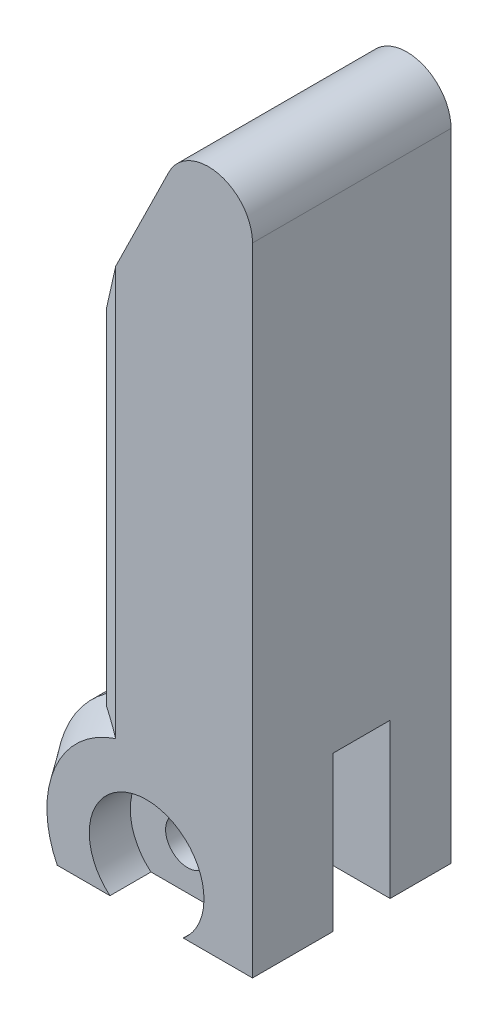
from build123d import *
from OCP.BRepFilletAPI import BRepFilletAPI_MakeChamfer

# Parameters (mm, degrees)
EXTRUDE_1_DEPTH     = 45
CHAMFER_1_SIZE      = 7
CHAMFER_1_SIZE2     = 4.901452767
CUT_EXTRUDE_START   = 13
CUT_EXTRUDE_1_DEPTH = 13
CUT_EXTRUDE_2_DEPTH = 6
CUT_EXTRUDE_3_DEPTH = 6
CHAMFER_START       = -1
CHAMFER_2_DEPTH     = 7
CHAMFER_3_SIZE      = 7
CHAMFER_3_SIZE2     = 4.901452767


with BuildPart() as part:
    # 草图1 → 凸台-拉伸1 (new body)
    with BuildSketch(Plane.XY):
        with BuildLine():
            Line((0, 0), (0, 144.272111773))
            ThreePointArc((0, 144.272111773), (-7.734402303, 154.012084416), (-18.973413415, 148.68548369))
            Line((-18.973413415, 148.68548369), (-38, 110))
            Line((-38, 110), (-38, 33.669600757))
            ThreePointArc((-38, 33.669600757), (-49.996050511, 18.969691065), (-49.617376915, 0))
            Line((-49.617376915, 0), (0, 0))
        make_face()
    extrude(amount=EXTRUDE_1_DEPTH)

    # 草图2 → 切除-旋转2 (revolve, cut)
    with BuildSketch(Plane(origin=(-24, 0, 0), x_dir=(0, 0, -1), z_dir=(1, 0, 0)), mode=Mode.PRIVATE) as cut_revolve_2_sk:
        Polygon((-45, 23), (-45, 10), (0, 10), (0, 15), (-4.3, 15), (-10.3, 15), (-10.3, 12.5), (-14.3, 12.5), (-14.3, 14), (-13.8, 14), (-13.8, 35), (-26.8, 35), (-26.8, 14), (-26.3, 14), (-26.3, 12.5), (-30.8, 12.5), (-30.8, 15), (-35.7, 15), (-35.7, 23), align=None)
    revolve(cut_revolve_2_sk.sketch.rotate(Axis((-24, 10, 45), (0, 0, -1)), 90), axis=Axis((-24, 10, 45), (0, 0, -1)), mode=Mode.SUBTRACT)

    # 倒角1
    chamfer_1_edges = [part.edges().sort_by_distance(p)[0] for p in [
        (-49.996050511, 18.969691065, 45),
        (-49.996050511, 18.969691065, 0),
    ]]
    chamfer_1_side = [part.faces().sort_by_distance(p)[0] for p in [
        (-49.996050511, 18.969691065, 22.5),
    ]]
    chamfer(chamfer_1_edges, length=CHAMFER_1_SIZE, length2=CHAMFER_1_SIZE2, reference=chamfer_1_side[0])

    # 草图4 → 切除-拉伸1 (cut)
    with BuildSketch(Plane.XY.offset(13.8).offset(CUT_EXTRUDE_START)):
        with BuildLine():
            Line((-24, 35), (0, 35))
            Line((0, 35), (0, 17))
            ThreePointArc((0, 17), (-9, 30), (-24, 35))
        make_face()
        with BuildLine():
            Line((-1.087121525, 0), (0, 0))
            Line((0, 0), (0, 3))
            ThreePointArc((0, 3), (-0.495648452, 1.482637832), (-1.087121525, 0))
        make_face()
    extrude(amount=-CUT_EXTRUDE_1_DEPTH, mode=Mode.SUBTRACT)

    # 草图7 → 切除-拉伸2 (cut)
    with BuildSketch(Plane(origin=(0, 0, 0), x_dir=(-1, 0, 0), z_dir=(0, 0, -1))):
        with BuildLine():
            Line((27.95, 1.469792729), (27.95, 4.702830945))
            ThreePointArc((27.95, 4.702830945), (28.032732694, 5.101103075), (28.267241379, 5.433474952))
            ThreePointArc((28.267241379, 5.433474952), (30.25, 10), (28.267241379, 14.566525048))
            ThreePointArc((28.267241379, 14.566525048), (28.032732694, 14.898896925), (27.95, 15.297169055))
            Line((27.95, 15.297169055), (27.95, 18.530207271))
            ThreePointArc((27.95, 18.530207271), (27.928074545, 18.997939916), (27.862490469, 19.46157046))
            Line((27.862490469, 19.46157046), (26.357995425, 27.397054331))
            ThreePointArc((26.357995425, 27.397054331), (24, 29.35), (21.642004575, 27.397054331))
            Line((21.642004575, 27.397054331), (20.137509531, 19.46157046))
            ThreePointArc((20.137509531, 19.46157046), (20.071925455, 18.997939916), (20.05, 18.530207271))
            Line((20.05, 18.530207271), (20.05, 15.297169055))
            ThreePointArc((20.05, 15.297169055), (19.967267306, 14.898896925), (19.732758621, 14.566525048))
            ThreePointArc((19.732758621, 14.566525048), (17.75, 10), (19.732758621, 5.433474952))
            ThreePointArc((19.732758621, 5.433474952), (19.967267306, 5.101103075), (20.05, 4.702830945))
            Line((20.05, 4.702830945), (20.05, 1.469792729))
            ThreePointArc((20.05, 1.469792729), (20.071925455, 1.002060084), (20.137509531, 0.53842954))
            Line((20.137509531, 0.53842954), (21.642004575, -7.397054331))
            ThreePointArc((21.642004575, -7.397054331), (24, -9.35), (26.357995425, -7.397054331))
            Line((26.357995425, -7.397054331), (27.862490469, 0.53842954))
            ThreePointArc((27.862490469, 0.53842954), (27.928074545, 1.002060084), (27.95, 1.469792729))
        make_face()
    extrude(amount=-CUT_EXTRUDE_2_DEPTH, mode=Mode.SUBTRACT)

    # 草图9 → 切除-拉伸3 (cut)
    with BuildSketch(Plane(origin=(0, 0, 0), x_dir=(-1, 0, 0), z_dir=(0, 0, -1))):
        with BuildLine():
            Line((20.137509531, 19.46157046), (19.478101846, 15.983513774))
            ThreePointArc((19.478101846, 15.983513774), (16.508016808, 9.653318796), (20.05, 3.624460807))
            Line((20.05, 3.624460807), (27.95, 3.624460807))
            ThreePointArc((27.95, 3.624460807), (31.491983192, 9.653318796), (28.521898154, 15.983513774))
            Line((28.521898154, 15.983513774), (27.862490469, 19.46157046))
            Line((27.862490469, 19.46157046), (20.137509531, 19.46157046))
        make_face()
    extrude(amount=-CUT_EXTRUDE_3_DEPTH, mode=Mode.SUBTRACT)

    # 倒角2: read off the stored shape, not the designer's step
    # 倒角2 outline → 倒角2 (cut)
    with BuildSketch(Plane.XY.offset(CHAMFER_START)):
        with BuildLine():
            Line((-20.239590839, 0), (-19.257196744, 0))
            Line((-19.257196744, 0), (-20.080386265, 0.919393486))
            ThreePointArc((-20.080386265, 0.919393486), (-20.105277636, 0.728361179), (-20.137509531, 0.53842954))
            Line((-20.137509531, 0.53842954), (-20.239590839, 0))
        make_face()
        with BuildLine():
            Line((-28.742803256, 0), (-27.760409161, 0))
            Line((-27.760409161, 0), (-27.862490469, 0.53842954))
            ThreePointArc((-27.862490469, 0.53842954), (-27.894722364, 0.728361179), (-27.919613735, 0.919393486))
            Line((-27.919613735, 0.919393486), (-28.742803256, 0))
        make_face()
    extrude(amount=CHAMFER_2_DEPTH, mode=Mode.SUBTRACT)

    # 倒角3: one chamfer whose edges measure the first distance from different faces: ONE call of the kernel's chamfer builder (chamfer() names one face for all edges)
    chamfer_3_edges_1 = [part.edges().sort_by_distance(p)[0] for p in [
        (-38, 68.86981309, 45),
    ]]
    chamfer_3_side_1 = [part.faces().sort_by_distance(p)[0] for p in [
        (-18.29172725, 74.905702605, 45),
    ]]
    chamfer_3_edges_2 = [part.edges().sort_by_distance(p)[0] for p in [
        (-38, 68.86981309, 0),
    ]]
    chamfer_3_side_2 = [part.faces().sort_by_distance(p)[0] for p in [
        (-18.531236566, 72.11524923, 0),
    ]]
    chamfer_3 = BRepFilletAPI_MakeChamfer(part.part.solid().wrapped)
    for e in chamfer_3_edges_1:
        chamfer_3.Add(CHAMFER_3_SIZE, CHAMFER_3_SIZE2, e.wrapped, chamfer_3_side_1[0].wrapped)  # the first distance lies on this face
    for e in chamfer_3_edges_2:
        chamfer_3.Add(CHAMFER_3_SIZE, CHAMFER_3_SIZE2, e.wrapped, chamfer_3_side_2[0].wrapped)  # the first distance lies on this face
    add(Compound.cast(chamfer_3.Shape()), mode=Mode.REPLACE)


solid = part.part
